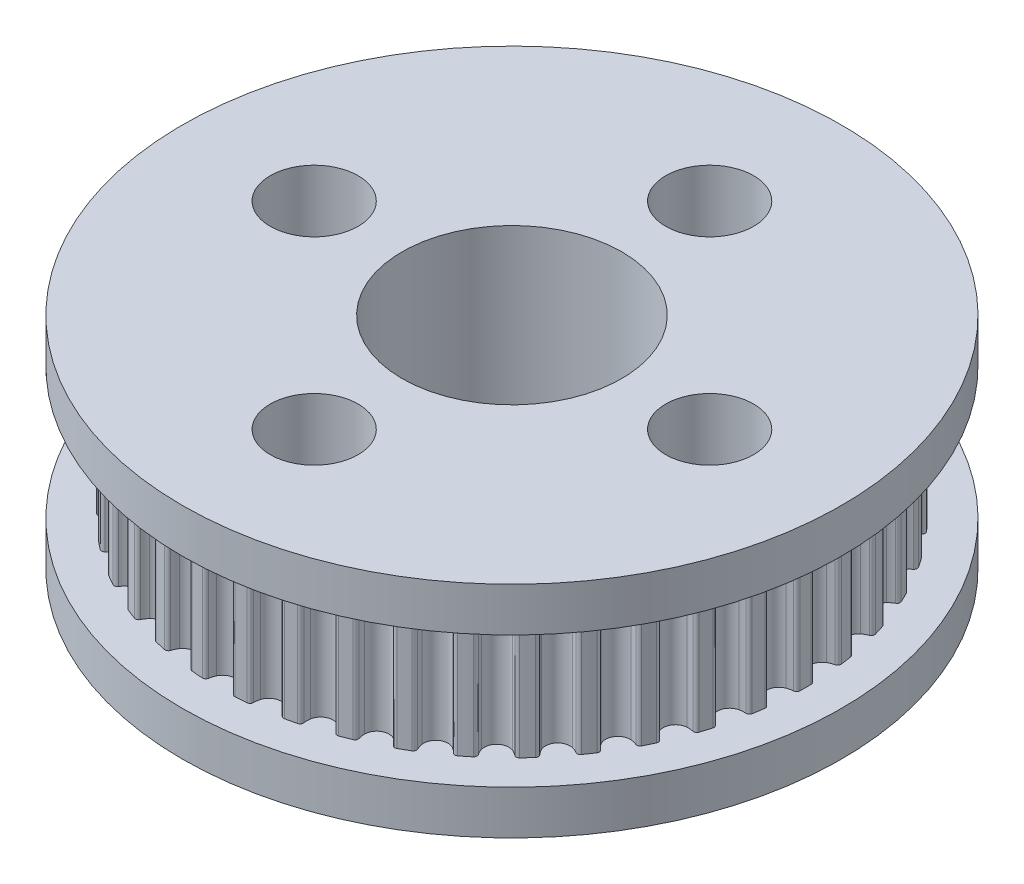
from build123d import *

# Parameters (mm, degrees)
BOSS_EXTRUDE1_DEPTH = 5
SKETCH3_R           = 15
BOSS_EXTRUDE2_DEPTH = 2
SKETCH4_R           = 2
SKETCH4_R_2         = 5
CUT_EXTRUDE1_DEPTH  = 24.452078799
SKETCH5_R           = 3.5
CUT_EXTRUDE2_DEPTH  = 2


with BuildPart() as part:
    # Sketch2 → Boss-Extrude1 (new, symmetric)
    with BuildSketch(Plane(origin=(0, 0, 0), x_dir=(1, 0, 0), z_dir=(0, 1, 0))):
        with BuildLine():
            ThreePointArc((-0.587933358, 13.215922323), (-0.641402083, 13.310557741), (-0.744749539, 13.344233703))
            ThreePointArc((-0.744749539, 13.344233703), (-0.998767701, 13.327628749), (-1.252423529, 13.306188797))
            ThreePointArc((-1.252423529, 13.306188797), (-1.349597538, 13.257485829), (-1.388364385, 13.15593831))
            ThreePointArc((-1.388364385, 13.15593831), (-1.398406592, 13.008375791), (-1.43010426, 12.863908491))
            ThreePointArc((-1.43010426, 12.863908491), (-1.880019146, 12.473112042), (-2.42513485, 12.713931761))
            ThreePointArc((-2.42513485, 12.713931761), (-2.498006764, 12.842637732), (-2.55109764, 12.98068447))
            ThreePointArc((-2.55109764, 12.98068447), (-2.618073842, 13.066293789), (-2.725286134, 13.084190479))
            ThreePointArc((-2.725286134, 13.084190479), (-2.973992282, 13.029911546), (-3.221619526, 12.970905621))
            ThreePointArc((-3.221619526, 12.970905621), (-3.31044938, 12.90826359), (-3.333648361, 12.802072375))
            ThreePointArc((-3.333648361, 12.802072375), (-3.321585353, 12.654661294), (-3.331397251, 12.507083282))
            ThreePointArc((-3.331397251, 12.507083282), (-3.71804177, 12.053595372), (-4.292961299, 12.210480054))
            ThreePointArc((-4.292961299, 12.210480054), (-4.384201924, 12.326887491), (-4.457274617, 12.455479576))
            ThreePointArc((-4.457274617, 12.455479576), (-4.536262157, 12.530150425), (-4.644944339, 12.53186806))
            ThreePointArc((-4.644944339, 12.53186806), (-4.882782791, 12.441127651), (-5.118849866, 12.345873847))
            ThreePointArc((-5.118849866, 12.345873847), (-5.197351254, 12.270692074), (-5.204464142, 12.162229297))
            ThreePointArc((-5.204464142, 12.162229297), (-5.170565386, 12.018262574), (-5.158272331, 11.8708705))
            ThreePointArc((-5.158272331, 11.8708705), (-5.473009485, 11.3648213), (-6.064890087, 11.4342664))
            ThreePointArc((-6.064890087, 11.4342664), (-6.172461257, 11.535774952), (-6.263883445, 11.65203985))
            ThreePointArc((-6.263883445, 11.65203985), (-6.353117871, 11.714104205), (-6.460842164, 11.699604418))
            ThreePointArc((-6.460842164, 11.699604418), (-6.6825, 11.574429522), (-6.901733558, 11.445055653))
            ThreePointArc((-6.901733558, 11.445055653), (-6.968152889, 11.359013573), (-6.959020794, 11.250702115))
            ThreePointArc((-6.959020794, 11.250702115), (-6.904043532, 11.113395729), (-6.869920132, 10.969482086))
            ThreePointArc((-6.869920132, 10.969482086), (-7.105719212, 10.422175899), (-7.701339252, 10.402630129))
            ThreePointArc((-7.701339252, 10.402630129), (-7.822838006, 10.486972263), (-7.930567467, 10.588312808))
            ThreePointArc((-7.930567467, 10.588312808), (-8.028055431, 10.636384255), (-8.132415451, 10.605990945))
            ThreePointArc((-8.132415451, 10.605990945), (-8.332941202, 10.449177763), (-8.530443928, 10.288573827))
            ThreePointArc((-8.530443928, 10.288573827), (-8.583297503, 10.193593478), (-8.55812442, 10.087852838))
            ThreePointArc((-8.55812442, 10.087852838), (-8.483296754, 9.960273987), (-8.428105269, 9.82305357))
            ThreePointArc((-8.428105269, 9.82305357), (-8.579698914, 9.246716311), (-9.165753224, 9.13861629))
            ThreePointArc((-9.165753224, 9.13861629), (-9.29846548, 9.203907943), (-9.420095717, 9.288060355))
            ThreePointArc((-9.420095717, 9.288060355), (-9.523659498, 9.321065057), (-9.622324015, 9.275457161))
            ThreePointArc((-9.622324015, 9.275457161), (-9.797238267, 9.09050864), (-9.968598276, 8.902262264))
            ThreePointArc((-9.968598276, 8.902262264), (-10.006705434, 8.80046535), (-9.966053689, 8.699657599))
            ThreePointArc((-9.966053689, 8.699657599), (-9.873047146, 8.584656183), (-9.798020462, 8.457194269))
            ThreePointArc((-9.798020462, 8.457194269), (-9.86202232, 7.864700361), (-10.425419415, 7.670460865))
            ThreePointArc((-10.425419415, 7.670460865), (-10.566380601, 7.715243529), (-10.699194595, 7.780327982))
            ThreePointArc((-10.699194595, 7.780327982), (-10.806520749, 7.797528667), (-10.897285761, 7.737724991))
            ThreePointArc((-10.897285761, 7.737724991), (-11.042681219, 7.528772576), (-11.184070611, 7.317088872))
            ThreePointArc((-11.184070611, 7.317088872), (-11.206580101, 7.210749369), (-11.151357787, 7.117126385))
            ThreePointArc((-11.151357787, 7.117126385), (-11.042249978, 7.017271346), (-10.949064068, 6.902415222))
            ThreePointArc((-10.949064068, 6.902415222), (-10.924044443, 6.307), (-11.452198964, 6.030960019))
            ThreePointArc((-11.452198964, 6.030960019), (-11.59826024, 6.054233323), (-11.739291145, 6.098795938))
            ThreePointArc((-11.739291145, 6.098795938), (-11.847982184, 6.099808373), (-11.928820151, 6.027144831))
            ThreePointArc((-11.928820151, 6.027144831), (-12.04144892, 5.798856173), (-12.14970929, 5.568463806))
            ThreePointArc((-12.14970929, 5.568463806), (-12.156118287, 5.459957162), (-12.087558979, 5.375610328))
            ThreePointArc((-12.087558979, 5.375610328), (-11.964787193, 5.293132262), (-11.855523675, 5.193447626))
            ThreePointArc((-11.855523675, 5.193447626), (-11.742041465, 4.608411681), (-12.223155312, 4.256737492))
            ThreePointArc((-12.223155312, 4.256737492), (-12.37105391, 4.257981549), (-12.51715133, 4.281026871))
            ThreePointArc((-12.51715133, 4.281026871), (-12.624779275, 4.265828439), (-12.69388441, 4.181928215))
            ThreePointArc((-12.69388441, 4.181928215), (-12.771230549, 3.939402906), (-12.843943541, 3.69544846))
            ThreePointArc((-12.843943541, 3.69544846), (-12.834108878, 3.587198534), (-12.753744078, 3.514012019))
            ThreePointArc((-12.753744078, 3.514012019), (-12.620050833, 3.45075335), (-12.497150475, 3.368466992))
            ThreePointArc((-12.497150475, 3.368466992), (-12.297740684, 2.806879061), (-12.721066569, 2.387426484))
            ThreePointArc((-12.721066569, 2.387426484), (-12.867498678, 2.366613504), (-13.015399038, 2.367626738))
            ThreePointArc((-13.015399038, 2.367626738), (-13.119559659, 2.336556946), (-13.175388267, 2.243294233))
            ThreePointArc((-13.175388267, 2.243294233), (-13.215723992, 1.991949887), (-13.251265316, 1.739882902))
            ThreePointArc((-13.251265316, 1.739882902), (-13.225406685, 1.634307819), (-13.135031609, 1.573916489))
            ThreePointArc((-13.135031609, 1.573916489), (-12.993403392, 1.531290311), (-12.859611583, 1.468240371))
            ThreePointArc((-12.859611583, 1.468240371), (-12.578728698, 0.9426454), (-12.934810219, 0.464784313))
            ThreePointArc((-12.934810219, 0.464784313), (-13.076504789, 0.422379223), (-13.222904238, 0.401337735))
            ThreePointArc((-13.222904238, 0.401337735), (-13.32127076, 0.355090633), (-13.362575722, 0.254548765))
            ThreePointArc((-13.362575722, 0.254548765), (-13.365, 0), (-13.362575722, -0.254548765))
            ThreePointArc((-13.362575722, -0.254548765), (-13.32127076, -0.355090633), (-13.222904238, -0.401337735))
            ThreePointArc((-13.222904238, -0.401337735), (-13.076504789, -0.422379223), (-12.934810219, -0.464784313))
            ThreePointArc((-12.934810219, -0.464784313), (-12.578728698, -0.9426454), (-12.859611583, -1.468240371))
            ThreePointArc((-12.859611583, -1.468240371), (-12.993403392, -1.531290311), (-13.135031609, -1.573916489))
            ThreePointArc((-13.135031609, -1.573916489), (-13.225406685, -1.634307819), (-13.251265316, -1.739882902))
            ThreePointArc((-13.251265316, -1.739882902), (-13.215723992, -1.991949887), (-13.175388267, -2.243294233))
            ThreePointArc((-13.175388267, -2.243294233), (-13.119559659, -2.336556946), (-13.015399038, -2.367626738))
            ThreePointArc((-13.015399038, -2.367626738), (-12.867498678, -2.366613504), (-12.721066569, -2.387426484))
            ThreePointArc((-12.721066569, -2.387426484), (-12.297740684, -2.806879061), (-12.497150475, -3.368466992))
            ThreePointArc((-12.497150475, -3.368466992), (-12.620050833, -3.45075335), (-12.753744078, -3.514012019))
            ThreePointArc((-12.753744078, -3.514012019), (-12.834108878, -3.587198534), (-12.843943541, -3.69544846))
            ThreePointArc((-12.843943541, -3.69544846), (-12.771230549, -3.939402906), (-12.69388441, -4.181928215))
            ThreePointArc((-12.69388441, -4.181928215), (-12.624779275, -4.265828439), (-12.51715133, -4.281026871))
            ThreePointArc((-12.51715133, -4.281026871), (-12.37105391, -4.257981549), (-12.223155312, -4.256737492))
            ThreePointArc((-12.223155312, -4.256737492), (-11.742041465, -4.608411681), (-11.855523675, -5.193447626))
            ThreePointArc((-11.855523675, -5.193447626), (-11.964787193, -5.293132262), (-12.087558979, -5.375610328))
            ThreePointArc((-12.087558979, -5.375610328), (-12.156118287, -5.459957162), (-12.14970929, -5.568463806))
            ThreePointArc((-12.14970929, -5.568463806), (-12.04144892, -5.798856173), (-11.928820151, -6.027144831))
            ThreePointArc((-11.928820151, -6.027144831), (-11.847982184, -6.099808373), (-11.739291145, -6.098795938))
            ThreePointArc((-11.739291145, -6.098795938), (-11.59826024, -6.054233323), (-11.452198964, -6.030960019))
            ThreePointArc((-11.452198964, -6.030960019), (-10.924044443, -6.307), (-10.949064068, -6.902415222))
            ThreePointArc((-10.949064068, -6.902415222), (-11.042249978, -7.017271346), (-11.151357787, -7.117126385))
            ThreePointArc((-11.151357787, -7.117126385), (-11.206580101, -7.210749369), (-11.184070611, -7.317088872))
            ThreePointArc((-11.184070611, -7.317088872), (-11.042681219, -7.528772576), (-10.897285761, -7.737724991))
            ThreePointArc((-10.897285761, -7.737724991), (-10.806520749, -7.797528667), (-10.699194595, -7.780327982))
            ThreePointArc((-10.699194595, -7.780327982), (-10.566380601, -7.715243529), (-10.425419415, -7.670460865))
            ThreePointArc((-10.425419415, -7.670460865), (-9.86202232, -7.864700361), (-9.798020462, -8.457194269))
            ThreePointArc((-9.798020462, -8.457194269), (-9.873047146, -8.584656183), (-9.966053689, -8.699657599))
            ThreePointArc((-9.966053689, -8.699657599), (-10.006705434, -8.80046535), (-9.968598276, -8.902262264))
            ThreePointArc((-9.968598276, -8.902262264), (-9.797238267, -9.09050864), (-9.622324015, -9.275457161))
            ThreePointArc((-9.622324015, -9.275457161), (-9.523659498, -9.321065057), (-9.420095717, -9.288060355))
            ThreePointArc((-9.420095717, -9.288060355), (-9.29846548, -9.203907943), (-9.165753224, -9.13861629))
            ThreePointArc((-9.165753224, -9.13861629), (-8.579698914, -9.246716311), (-8.428105269, -9.82305357))
            ThreePointArc((-8.428105269, -9.82305357), (-8.483296754, -9.960273987), (-8.55812442, -10.087852838))
            ThreePointArc((-8.55812442, -10.087852838), (-8.583297503, -10.193593478), (-8.530443928, -10.288573827))
            ThreePointArc((-8.530443928, -10.288573827), (-8.332941202, -10.449177763), (-8.132415451, -10.605990945))
            ThreePointArc((-8.132415451, -10.605990945), (-8.028055431, -10.636384255), (-7.930567467, -10.588312808))
            ThreePointArc((-7.930567467, -10.588312808), (-7.822838006, -10.486972263), (-7.701339252, -10.402630129))
            ThreePointArc((-7.701339252, -10.402630129), (-7.105719212, -10.422175899), (-6.869920132, -10.969482086))
            ThreePointArc((-6.869920132, -10.969482086), (-6.904043532, -11.113395729), (-6.959020794, -11.250702115))
            ThreePointArc((-6.959020794, -11.250702115), (-6.968152889, -11.359013573), (-6.901733558, -11.445055653))
            ThreePointArc((-6.901733558, -11.445055653), (-6.6825, -11.574429522), (-6.460842164, -11.699604418))
            ThreePointArc((-6.460842164, -11.699604418), (-6.353117871, -11.714104205), (-6.263883445, -11.65203985))
            ThreePointArc((-6.263883445, -11.65203985), (-6.172461257, -11.535774952), (-6.064890087, -11.4342664))
            ThreePointArc((-6.064890087, -11.4342664), (-5.473009485, -11.3648213), (-5.158272331, -11.8708705))
            ThreePointArc((-5.158272331, -11.8708705), (-5.170565386, -12.018262574), (-5.204464142, -12.162229297))
            ThreePointArc((-5.204464142, -12.162229297), (-5.197351254, -12.270692074), (-5.118849866, -12.345873847))
            ThreePointArc((-5.118849866, -12.345873847), (-4.882782791, -12.441127651), (-4.644944339, -12.53186806))
            ThreePointArc((-4.644944339, -12.53186806), (-4.536262157, -12.530150425), (-4.457274617, -12.455479576))
            ThreePointArc((-4.457274617, -12.455479576), (-4.384201924, -12.326887491), (-4.292961299, -12.210480054))
            ThreePointArc((-4.292961299, -12.210480054), (-3.71804177, -12.053595372), (-3.331397251, -12.507083282))
            ThreePointArc((-3.331397251, -12.507083282), (-3.321585353, -12.654661294), (-3.333648361, -12.802072375))
            ThreePointArc((-3.333648361, -12.802072375), (-3.31044938, -12.90826359), (-3.221619526, -12.970905621))
            ThreePointArc((-3.221619526, -12.970905621), (-2.973992282, -13.029911546), (-2.725286134, -13.084190479))
            ThreePointArc((-2.725286134, -13.084190479), (-2.618073842, -13.066293789), (-2.55109764, -12.98068447))
            ThreePointArc((-2.55109764, -12.98068447), (-2.498006764, -12.842637732), (-2.42513485, -12.713931761))
            ThreePointArc((-2.42513485, -12.713931761), (-1.880019146, -12.473112042), (-1.43010426, -12.863908491))
            ThreePointArc((-1.43010426, -12.863908491), (-1.398406592, -13.008375791), (-1.388364385, -13.15593831))
            ThreePointArc((-1.388364385, -13.15593831), (-1.349597538, -13.257485829), (-1.252423529, -13.306188797))
            ThreePointArc((-1.252423529, -13.306188797), (-0.998767701, -13.327628749), (-0.744749539, -13.344233703))
            ThreePointArc((-0.744749539, -13.344233703), (-0.641402083, -13.310557741), (-0.587933358, -13.215922323))
            ThreePointArc((-0.587933358, -13.215922323), (-0.556010261, -13.071504669), (-0.503134896, -12.933375242))
            ThreePointArc((-0.503134896, -12.933375242), (0, -12.614), (0.503134896, -12.933375242))
            ThreePointArc((0.503134896, -12.933375242), (0.556010261, -13.071504669), (0.587933358, -13.215922323))
            ThreePointArc((0.587933358, -13.215922323), (0.641402083, -13.310557741), (0.744749539, -13.344233703))
            ThreePointArc((0.744749539, -13.344233703), (0.998767701, -13.327628749), (1.252423529, -13.306188797))
            ThreePointArc((1.252423529, -13.306188797), (1.349597538, -13.257485829), (1.388364385, -13.15593831))
            ThreePointArc((1.388364385, -13.15593831), (1.398406592, -13.008375791), (1.43010426, -12.863908491))
            ThreePointArc((1.43010426, -12.863908491), (1.880019146, -12.473112042), (2.42513485, -12.713931761))
            ThreePointArc((2.42513485, -12.713931761), (2.498006764, -12.842637732), (2.55109764, -12.98068447))
            ThreePointArc((2.55109764, -12.98068447), (2.618073842, -13.066293789), (2.725286134, -13.084190479))
            ThreePointArc((2.725286134, -13.084190479), (2.973992282, -13.029911546), (3.221619526, -12.970905621))
            ThreePointArc((3.221619526, -12.970905621), (3.31044938, -12.90826359), (3.333648361, -12.802072375))
            ThreePointArc((3.333648361, -12.802072375), (3.321585353, -12.654661294), (3.331397251, -12.507083282))
            ThreePointArc((3.331397251, -12.507083282), (3.71804177, -12.053595372), (4.292961299, -12.210480054))
            ThreePointArc((4.292961299, -12.210480054), (4.384201924, -12.326887491), (4.457274617, -12.455479576))
            ThreePointArc((4.457274617, -12.455479576), (4.536262157, -12.530150425), (4.644944339, -12.53186806))
            ThreePointArc((4.644944339, -12.53186806), (4.882782791, -12.441127651), (5.118849866, -12.345873847))
            ThreePointArc((5.118849866, -12.345873847), (5.197351254, -12.270692074), (5.204464142, -12.162229297))
            ThreePointArc((5.204464142, -12.162229297), (5.170565386, -12.018262574), (5.158272331, -11.8708705))
            ThreePointArc((5.158272331, -11.8708705), (5.473009485, -11.3648213), (6.064890087, -11.4342664))
            ThreePointArc((6.064890087, -11.4342664), (6.172461257, -11.535774952), (6.263883445, -11.65203985))
            ThreePointArc((6.263883445, -11.65203985), (6.353117871, -11.714104205), (6.460842164, -11.699604418))
            ThreePointArc((6.460842164, -11.699604418), (6.6825, -11.574429522), (6.901733558, -11.445055653))
            ThreePointArc((6.901733558, -11.445055653), (6.968152889, -11.359013573), (6.959020794, -11.250702115))
            ThreePointArc((6.959020794, -11.250702115), (6.904043532, -11.113395729), (6.869920132, -10.969482086))
            ThreePointArc((6.869920132, -10.969482086), (7.105719212, -10.422175899), (7.701339252, -10.402630129))
            ThreePointArc((7.701339252, -10.402630129), (7.822838006, -10.486972263), (7.930567467, -10.588312808))
            ThreePointArc((7.930567467, -10.588312808), (8.028055431, -10.636384255), (8.132415451, -10.605990945))
            ThreePointArc((8.132415451, -10.605990945), (8.332941202, -10.449177763), (8.530443928, -10.288573827))
            ThreePointArc((8.530443928, -10.288573827), (8.583297503, -10.193593478), (8.55812442, -10.087852838))
            ThreePointArc((8.55812442, -10.087852838), (8.483296754, -9.960273987), (8.428105269, -9.82305357))
            ThreePointArc((8.428105269, -9.82305357), (8.579698914, -9.246716311), (9.165753224, -9.13861629))
            ThreePointArc((9.165753224, -9.13861629), (9.29846548, -9.203907943), (9.420095717, -9.288060355))
            ThreePointArc((9.420095717, -9.288060355), (9.523659498, -9.321065057), (9.622324015, -9.275457161))
            ThreePointArc((9.622324015, -9.275457161), (9.797238267, -9.09050864), (9.968598276, -8.902262264))
            ThreePointArc((9.968598276, -8.902262264), (10.006705434, -8.80046535), (9.966053689, -8.699657599))
            ThreePointArc((9.966053689, -8.699657599), (9.873047146, -8.584656183), (9.798020462, -8.457194269))
            ThreePointArc((9.798020462, -8.457194269), (9.86202232, -7.864700361), (10.425419415, -7.670460865))
            ThreePointArc((10.425419415, -7.670460865), (10.566380601, -7.715243529), (10.699194595, -7.780327982))
            ThreePointArc((10.699194595, -7.780327982), (10.806520749, -7.797528667), (10.897285761, -7.737724991))
            ThreePointArc((10.897285761, -7.737724991), (11.042681219, -7.528772576), (11.184070611, -7.317088872))
            ThreePointArc((11.184070611, -7.317088872), (11.206580101, -7.210749369), (11.151357787, -7.117126385))
            ThreePointArc((11.151357787, -7.117126385), (11.042249978, -7.017271346), (10.949064068, -6.902415222))
            ThreePointArc((10.949064068, -6.902415222), (10.924044443, -6.307), (11.452198964, -6.030960019))
            ThreePointArc((11.452198964, -6.030960019), (11.59826024, -6.054233323), (11.739291145, -6.098795938))
            ThreePointArc((11.739291145, -6.098795938), (11.847982184, -6.099808373), (11.928820151, -6.027144831))
            ThreePointArc((11.928820151, -6.027144831), (12.04144892, -5.798856173), (12.14970929, -5.568463806))
            ThreePointArc((12.14970929, -5.568463806), (12.156118287, -5.459957162), (12.087558979, -5.375610328))
            ThreePointArc((12.087558979, -5.375610328), (11.964787193, -5.293132262), (11.855523675, -5.193447626))
            ThreePointArc((11.855523675, -5.193447626), (11.742041465, -4.608411681), (12.223155312, -4.256737492))
            ThreePointArc((12.223155312, -4.256737492), (12.37105391, -4.257981549), (12.51715133, -4.281026871))
            ThreePointArc((12.51715133, -4.281026871), (12.624779275, -4.265828439), (12.69388441, -4.181928215))
            ThreePointArc((12.69388441, -4.181928215), (12.771230549, -3.939402906), (12.843943541, -3.69544846))
            ThreePointArc((12.843943541, -3.69544846), (12.834108878, -3.587198534), (12.753744078, -3.514012019))
            ThreePointArc((12.753744078, -3.514012019), (12.620050833, -3.45075335), (12.497150475, -3.368466992))
            ThreePointArc((12.497150475, -3.368466992), (12.297740684, -2.806879061), (12.721066569, -2.387426484))
            ThreePointArc((12.721066569, -2.387426484), (12.867498678, -2.366613504), (13.015399038, -2.367626738))
            ThreePointArc((13.015399038, -2.367626738), (13.119559659, -2.336556946), (13.175388267, -2.243294233))
            ThreePointArc((13.175388267, -2.243294233), (13.215723992, -1.991949887), (13.251265316, -1.739882902))
            ThreePointArc((13.251265316, -1.739882902), (13.225406685, -1.634307819), (13.135031609, -1.573916489))
            ThreePointArc((13.135031609, -1.573916489), (12.993403392, -1.531290311), (12.859611583, -1.468240371))
            ThreePointArc((12.859611583, -1.468240371), (12.578728698, -0.9426454), (12.934810219, -0.464784313))
            ThreePointArc((12.934810219, -0.464784313), (13.076504789, -0.422379223), (13.222904238, -0.401337735))
            ThreePointArc((13.222904238, -0.401337735), (13.32127076, -0.355090633), (13.362575722, -0.254548765))
            ThreePointArc((13.362575722, -0.254548765), (13.365, 0), (13.362575722, 0.254548765))
            ThreePointArc((13.362575722, 0.254548765), (13.32127076, 0.355090633), (13.222904238, 0.401337735))
            ThreePointArc((13.222904238, 0.401337735), (13.076504789, 0.422379223), (12.934810219, 0.464784313))
            ThreePointArc((12.934810219, 0.464784313), (12.578728698, 0.9426454), (12.859611583, 1.468240371))
            ThreePointArc((12.859611583, 1.468240371), (12.993403392, 1.531290311), (13.135031609, 1.573916489))
            ThreePointArc((13.135031609, 1.573916489), (13.225406685, 1.634307819), (13.251265316, 1.739882902))
            ThreePointArc((13.251265316, 1.739882902), (13.215723992, 1.991949887), (13.175388267, 2.243294233))
            ThreePointArc((13.175388267, 2.243294233), (13.119559659, 2.336556946), (13.015399038, 2.367626738))
            ThreePointArc((13.015399038, 2.367626738), (12.867498678, 2.366613504), (12.721066569, 2.387426484))
            ThreePointArc((12.721066569, 2.387426484), (12.297740684, 2.806879061), (12.497150475, 3.368466992))
            ThreePointArc((12.497150475, 3.368466992), (12.620050833, 3.45075335), (12.753744078, 3.514012019))
            ThreePointArc((12.753744078, 3.514012019), (12.834108878, 3.587198534), (12.843943541, 3.69544846))
            ThreePointArc((12.843943541, 3.69544846), (12.771230549, 3.939402906), (12.69388441, 4.181928215))
            ThreePointArc((12.69388441, 4.181928215), (12.624779275, 4.265828439), (12.51715133, 4.281026871))
            ThreePointArc((12.51715133, 4.281026871), (12.37105391, 4.257981549), (12.223155312, 4.256737492))
            ThreePointArc((12.223155312, 4.256737492), (11.742041465, 4.608411681), (11.855523675, 5.193447626))
            ThreePointArc((11.855523675, 5.193447626), (11.964787193, 5.293132262), (12.087558979, 5.375610328))
            ThreePointArc((12.087558979, 5.375610328), (12.156118287, 5.459957162), (12.14970929, 5.568463806))
            ThreePointArc((12.14970929, 5.568463806), (12.04144892, 5.798856173), (11.928820151, 6.027144831))
            ThreePointArc((11.928820151, 6.027144831), (11.847982184, 6.099808373), (11.739291145, 6.098795938))
            ThreePointArc((11.739291145, 6.098795938), (11.59826024, 6.054233323), (11.452198964, 6.030960019))
            ThreePointArc((11.452198964, 6.030960019), (10.924044443, 6.307), (10.949064068, 6.902415222))
            ThreePointArc((10.949064068, 6.902415222), (11.042249978, 7.017271346), (11.151357787, 7.117126385))
            ThreePointArc((11.151357787, 7.117126385), (11.206580101, 7.210749369), (11.184070611, 7.317088872))
            ThreePointArc((11.184070611, 7.317088872), (11.042681219, 7.528772576), (10.897285761, 7.737724991))
            ThreePointArc((10.897285761, 7.737724991), (10.806520749, 7.797528667), (10.699194595, 7.780327982))
            ThreePointArc((10.699194595, 7.780327982), (10.566380601, 7.715243529), (10.425419415, 7.670460865))
            ThreePointArc((10.425419415, 7.670460865), (9.86202232, 7.864700361), (9.798020462, 8.457194269))
            ThreePointArc((9.798020462, 8.457194269), (9.873047146, 8.584656183), (9.966053689, 8.699657599))
            ThreePointArc((9.966053689, 8.699657599), (10.006705434, 8.80046535), (9.968598276, 8.902262264))
            ThreePointArc((9.968598276, 8.902262264), (9.797238267, 9.09050864), (9.622324015, 9.275457161))
            ThreePointArc((9.622324015, 9.275457161), (9.523659498, 9.321065057), (9.420095717, 9.288060355))
            ThreePointArc((9.420095717, 9.288060355), (9.29846548, 9.203907943), (9.165753224, 9.13861629))
            ThreePointArc((9.165753224, 9.13861629), (8.579698914, 9.246716311), (8.428105269, 9.82305357))
            ThreePointArc((8.428105269, 9.82305357), (8.483296754, 9.960273987), (8.55812442, 10.087852838))
            ThreePointArc((8.55812442, 10.087852838), (8.583297503, 10.193593478), (8.530443928, 10.288573827))
            ThreePointArc((8.530443928, 10.288573827), (8.332941202, 10.449177763), (8.132415451, 10.605990945))
            ThreePointArc((8.132415451, 10.605990945), (8.028055431, 10.636384255), (7.930567467, 10.588312808))
            ThreePointArc((7.930567467, 10.588312808), (7.822838006, 10.486972263), (7.701339252, 10.402630129))
            ThreePointArc((7.701339252, 10.402630129), (7.105719212, 10.422175899), (6.869920132, 10.969482086))
            ThreePointArc((6.869920132, 10.969482086), (6.904043532, 11.113395729), (6.959020794, 11.250702115))
            ThreePointArc((6.959020794, 11.250702115), (6.968152889, 11.359013573), (6.901733558, 11.445055653))
            ThreePointArc((6.901733558, 11.445055653), (6.6825, 11.574429522), (6.460842164, 11.699604418))
            ThreePointArc((6.460842164, 11.699604418), (6.353117871, 11.714104205), (6.263883445, 11.65203985))
            ThreePointArc((6.263883445, 11.65203985), (6.172461257, 11.535774952), (6.064890087, 11.4342664))
            ThreePointArc((6.064890087, 11.4342664), (5.473009485, 11.3648213), (5.158272331, 11.8708705))
            ThreePointArc((5.158272331, 11.8708705), (5.170565386, 12.018262574), (5.204464142, 12.162229297))
            ThreePointArc((5.204464142, 12.162229297), (5.197351254, 12.270692074), (5.118849866, 12.345873847))
            ThreePointArc((5.118849866, 12.345873847), (4.882782791, 12.441127651), (4.644944339, 12.53186806))
            ThreePointArc((4.644944339, 12.53186806), (4.536262157, 12.530150425), (4.457274617, 12.455479576))
            ThreePointArc((4.457274617, 12.455479576), (4.384201924, 12.326887491), (4.292961299, 12.210480054))
            ThreePointArc((4.292961299, 12.210480054), (3.71804177, 12.053595372), (3.331397251, 12.507083282))
            ThreePointArc((3.331397251, 12.507083282), (3.321585353, 12.654661294), (3.333648361, 12.802072375))
            ThreePointArc((3.333648361, 12.802072375), (3.31044938, 12.90826359), (3.221619526, 12.970905621))
            ThreePointArc((3.221619526, 12.970905621), (2.973992282, 13.029911546), (2.725286134, 13.084190479))
            ThreePointArc((2.725286134, 13.084190479), (2.618073842, 13.066293789), (2.55109764, 12.98068447))
            ThreePointArc((2.55109764, 12.98068447), (2.498006764, 12.842637732), (2.42513485, 12.713931761))
            ThreePointArc((2.42513485, 12.713931761), (1.880019146, 12.473112042), (1.43010426, 12.863908491))
            ThreePointArc((1.43010426, 12.863908491), (1.398406592, 13.008375791), (1.388364385, 13.15593831))
            ThreePointArc((1.388364385, 13.15593831), (1.349597538, 13.257485829), (1.252423529, 13.306188797))
            ThreePointArc((1.252423529, 13.306188797), (0.998767701, 13.327628749), (0.744749539, 13.344233703))
            ThreePointArc((0.744749539, 13.344233703), (0.641402083, 13.310557741), (0.587933358, 13.215922323))
            ThreePointArc((0.587933358, 13.215922323), (0.556010261, 13.071504669), (0.503134896, 12.933375242))
            ThreePointArc((0.503134896, 12.933375242), (0, 12.614), (-0.503134896, 12.933375242))
            ThreePointArc((-0.503134896, 12.933375242), (-0.556010261, 13.071504669), (-0.587933358, 13.215922323))
        make_face()
    extrude(amount=BOSS_EXTRUDE1_DEPTH, both=True)

    # Sketch3 → Boss-Extrude2 (add)
    with BuildSketch(Plane(origin=(0, 5, 0), x_dir=(1, 0, 0), z_dir=(0, 1, 0))):
        Circle(SKETCH3_R)
    boss_extrude2 = extrude(amount=-BOSS_EXTRUDE2_DEPTH)

    # Mirror1: Boss-Extrude2 across plane
    add(boss_extrude2.mirror(Plane.ZX))

    # Sketch4 → Cut-Extrude1 (cut, through all)
    with BuildSketch(Plane(origin=(0, 5, 0), x_dir=(1, 0, 0), z_dir=(0, 1, 0))):
        with Locations((9, 0)):
            Circle(SKETCH4_R)
        with Locations((0, 9)):
            Circle(SKETCH4_R)
        with Locations((0, -9)):
            Circle(SKETCH4_R)
        with Locations((-9, 0)):
            Circle(SKETCH4_R)
        Circle(SKETCH4_R_2)
    extrude(amount=-CUT_EXTRUDE1_DEPTH, mode=Mode.SUBTRACT)

    # Sketch5 → Cut-Extrude2 (cut)
    with BuildSketch(Plane.XZ.offset(5)):
        with Locations((0, 9)):
            Circle(SKETCH5_R)
        with Locations((9, 0)):
            Circle(SKETCH5_R)
        with Locations((0, -9)):
            Circle(SKETCH5_R)
        with Locations((-9, 0)):
            Circle(SKETCH5_R)
    extrude(amount=-CUT_EXTRUDE2_DEPTH, mode=Mode.SUBTRACT)


solid = part.part
